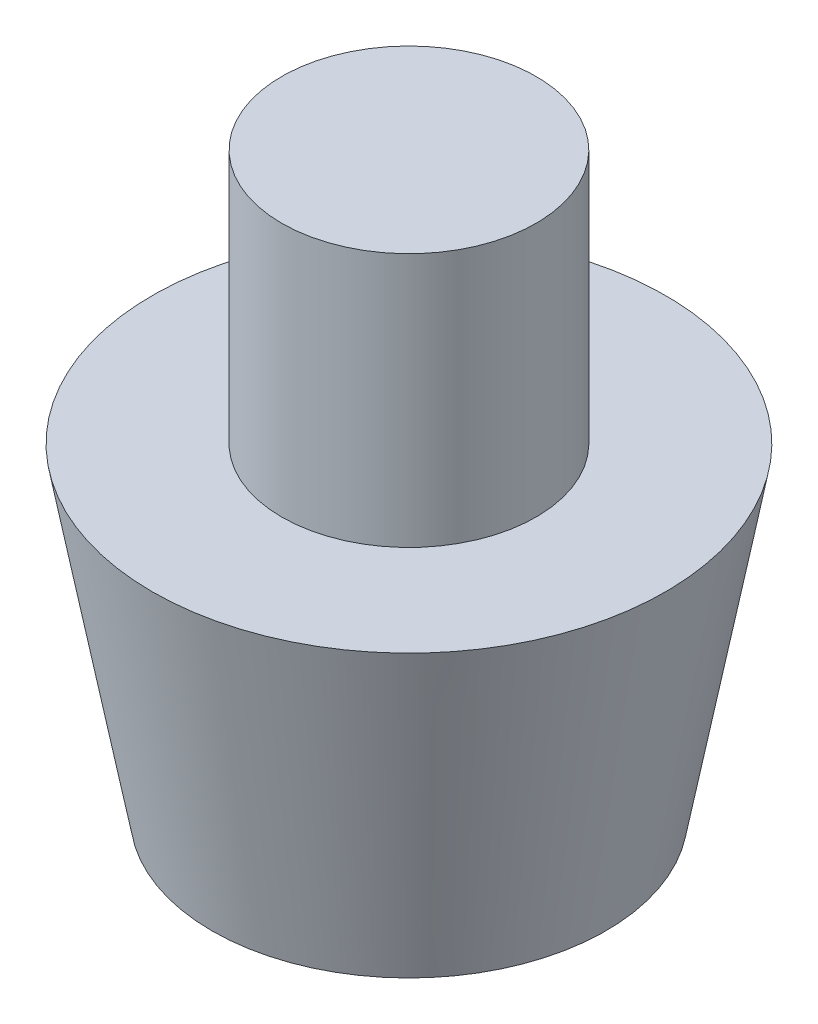
from build123d import *

# Parameters (mm, degrees)
SKETCH3_R           = 25
BOSS_EXTRUDE1_DEPTH = 50


with BuildPart() as part:
    # Sketch1 → Revolve1 (revolve)
    with BuildSketch(Plane.XY):
        Polygon((-78.026255414, 114.596985441), (-66.306059633, 51.023802263), (-27.593897809, 51.023802263), (-27.593897809, 114.596985441), align=None)
    revolve(axis=Axis((-27.593897809, 140.168321691, 0), (0, -1, 0)))

    # Sketch3 → Boss-Extrude1 (add)
    with BuildSketch(Plane(origin=(0, 114.596985441, 0), x_dir=(1, 0, 0), z_dir=(0, 1, 0))):
        with Locations((-27.593897809, 0)):
            Circle(SKETCH3_R)
    extrude(amount=BOSS_EXTRUDE1_DEPTH)


solid = part.part
